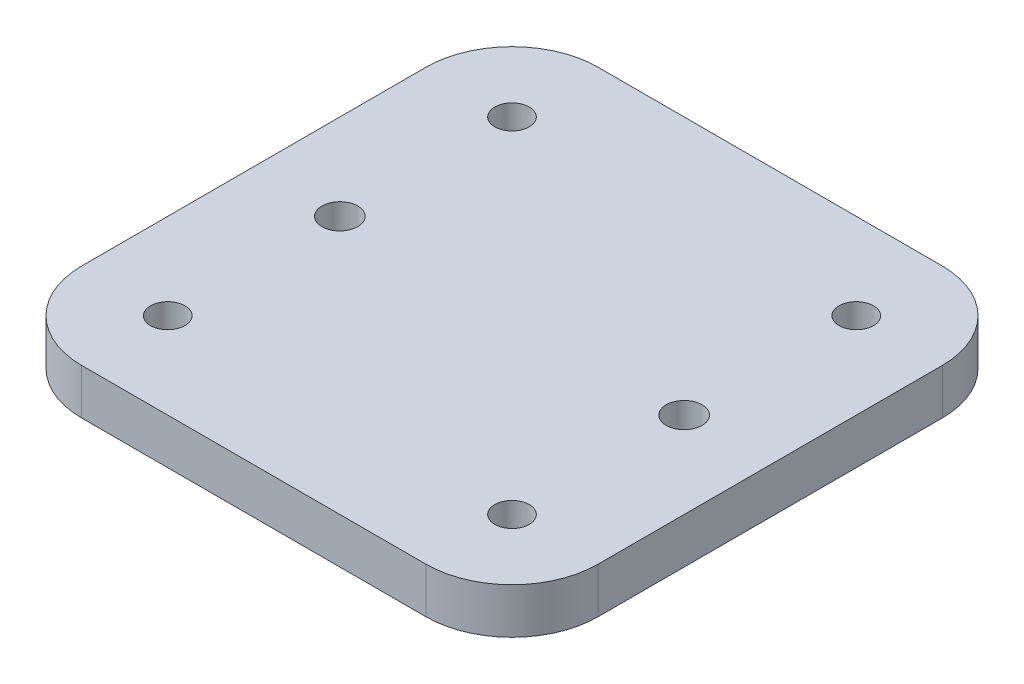
from build123d import *

# Parameters (mm, degrees)
BOSS_EXTRUDE1_DEPTH = 6.35
SKETCH2_R           = 2.4
CUT_EXTRUDE1_DEPTH  = 52.306164347
SKETCH3_R           = 2.5
CUT_EXTRUDE2_DEPTH  = 52.306164347


with BuildPart() as part:
    # Sketch1 → Boss-Extrude1 (new body)
    with BuildSketch(Plane(origin=(0, 0, 0), x_dir=(1, 0, 0), z_dir=(0, 1, 0))):
        with BuildLine():
            Line((-24, -36), (24, -36))
            ThreePointArc((24, -36), (32.485281374, -32.485281374), (36, -24))
            Line((36, -24), (36, 24))
            ThreePointArc((36, 24), (32.485281374, 32.485281374), (24, 36))
            Line((24, 36), (-24, 36))
            ThreePointArc((-24, 36), (-32.485281374, 32.485281374), (-36, 24))
            Line((-36, 24), (-36, -24))
            ThreePointArc((-36, -24), (-32.485281374, -32.485281374), (-24, -36))
        make_face()
    extrude(amount=BOSS_EXTRUDE1_DEPTH)

    # Sketch2 → Cut-Extrude1 (cut, through all)
    with BuildSketch(Plane(origin=(0, 6.35, 0), x_dir=(1, 0, 0), z_dir=(0, 1, 0))):
        with Locations((-24, 24)):
            Circle(SKETCH2_R)
        with Locations((24, 24)):
            Circle(SKETCH2_R)
        with Locations((24, -24)):
            Circle(SKETCH2_R)
        with Locations((-24, -24)):
            Circle(SKETCH2_R)
    extrude(amount=-CUT_EXTRUDE1_DEPTH, mode=Mode.SUBTRACT)

    # Sketch3 → Cut-Extrude2 (cut, through all)
    with BuildSketch(Plane(origin=(0, 6.35, 0), x_dir=(1, 0, 0), z_dir=(0, 1, 0))):
        with Locations((-24, 0)):
            Circle(SKETCH3_R)
        with Locations((24, 0)):
            Circle(SKETCH3_R)
    extrude(amount=-CUT_EXTRUDE2_DEPTH, mode=Mode.SUBTRACT)


solid = part.part
